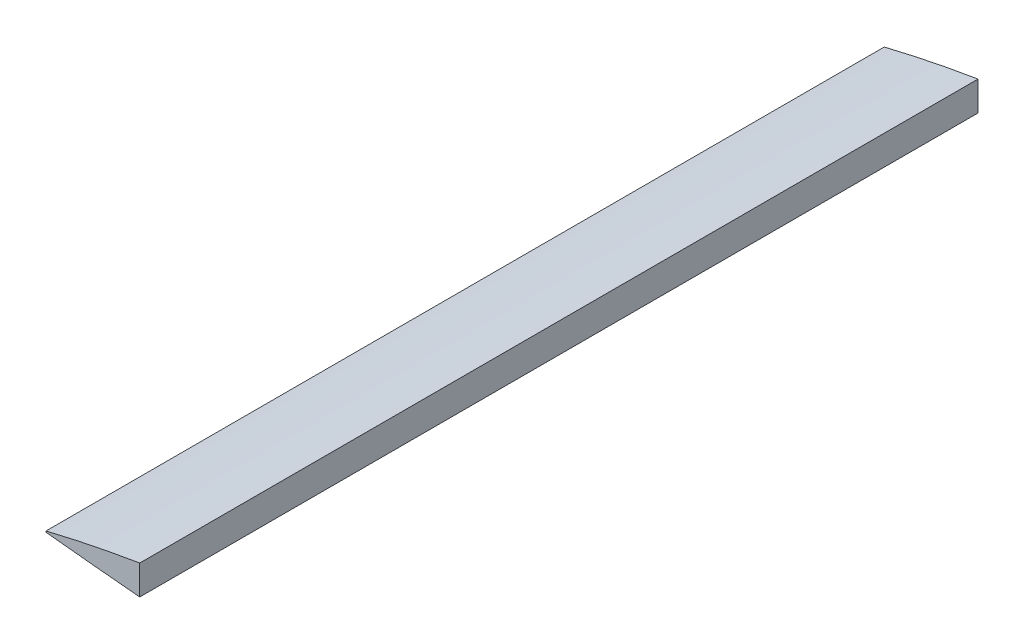
from build123d import *

# Parameters (mm, degrees)
BOSS_EXTRUDE1_DEPTH = 612
SKETCH2_W           = 21
SKETCH2_H           = 11.5
CUT_EXTRUDE1_DEPTH  = 13


with BuildPart() as part:
    # Sketch1 → Boss-Extrude1 (new body)
    with BuildSketch(Plane.XY):
        with BuildLine():
            Line((-194.78206, 14.362329856), (-194.78206, -7.118101813))
            add(Edge.make_bspline(
                [(-194.78206, -7.118101813), (-196.512686719, -6.961210383), (-201.112755742, -6.544187234), (-208.425137277, -5.864747708), (-216.54669625, -5.099699317), (-224.149671302, -4.371224172), (-231.185732748, -3.686594781), (-237.609816157, -3.051792113), (-243.380580393, -2.473170444), (-248.460634018, -1.95604425), (-252.81702039, -1.50811956), (-256.420946665, -1.129170423), (-259.24954449, -0.839207545), (-261.282177522, -0.605141161), (-262.509467907, -0.506345529), (-263.063019725, -0.413096521), (-263.209805993, -0.413618993), (-263.219, -0.413651718)],
                knots=[0, 0, 0, 0, 0.075810952, 0.201508279, 0.320388141, 0.43169539, 0.534719075, 0.628797147, 0.713321079, 0.787740393, 0.851567051, 0.904379655, 0.945827345, 0.975633259, 0.993597432, 0.999598973, 1, 1, 1, 1], degree=3))
            Line((-263.219, -0.413651718), (-263.219, 0.420386619))
            add(Edge.make_bspline(
                [(-194.78206, 14.362329856), (-196.780843948, 14.03082617), (-201.644283213, 13.224211706), (-209.199024776, 11.87840653), (-217.274846429, 10.378455268), (-224.816873175, 8.910515534), (-231.78070947, 7.49966041), (-238.124942714, 6.166292522), (-243.812252153, 4.931299241), (-248.809365304, 3.814412811), (-253.087249349, 2.834113315), (-256.62120211, 2.007090349), (-259.39094467, 1.34784408), (-261.380642681, 0.868109535), (-262.569816785, 0.578993853), (-263.094507616, 0.450802366), (-263.219, 0.420386619)],
                knots=[0, 0, 0, 0, 0.087007005, 0.211705365, 0.329527113, 0.439740645, 0.541660709, 0.634652346, 0.718134669, 0.791584505, 0.854539888, 0.906603358, 0.947445002, 0.976805146, 0.994496602, 1, 1, 1, 1], degree=3))
        make_face()
    extrude(amount=-BOSS_EXTRUDE1_DEPTH)

    # Sketch2 → Cut-Extrude1 (cut)
    with BuildSketch(Plane.XY.offset(-96.9)):
        with Locations((-207.415, -1.948)):
            Rectangle(SKETCH2_W, SKETCH2_H)
    extrude(amount=CUT_EXTRUDE1_DEPTH, mode=Mode.SUBTRACT)


solid = part.part
